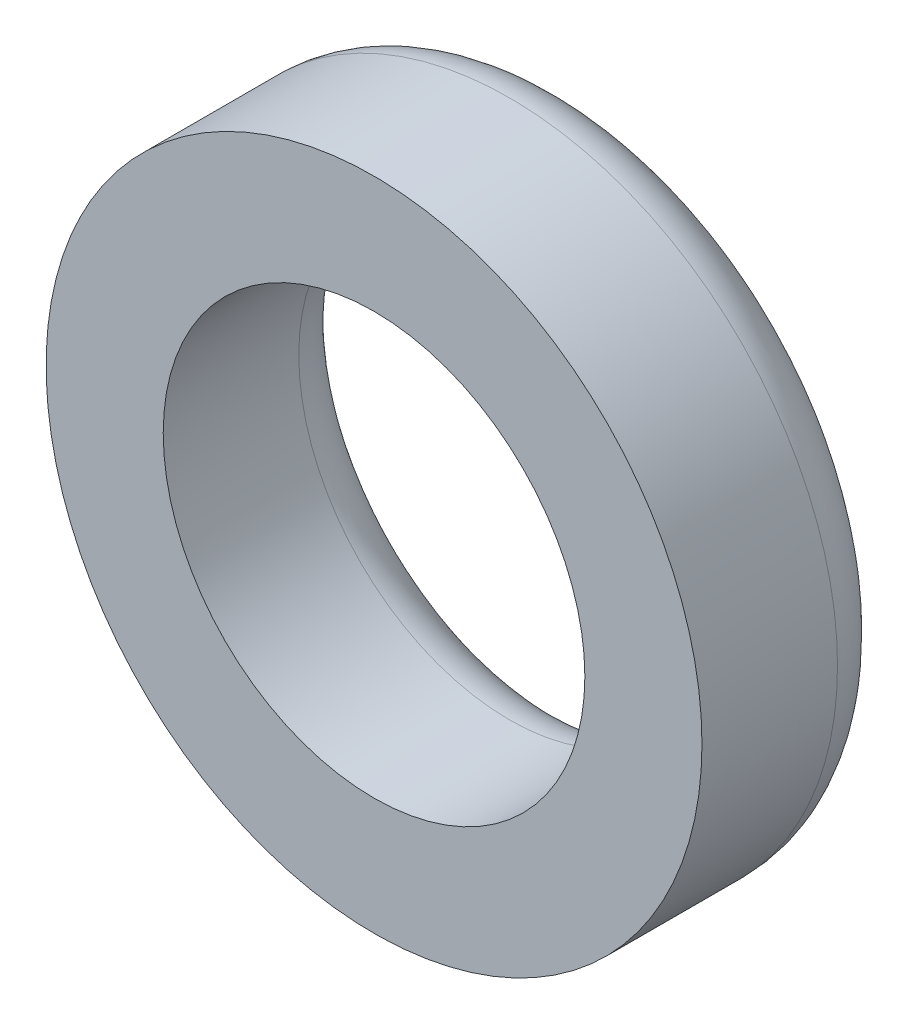
from build123d import *

# Parameters (mm, degrees)
CROQUIS1_W  = 3.5
CROQUIS1_H  = 5.8
REDONDEO1_R = 1.75


with BuildPart() as part:
    # Croquis1 → Revolución1 (revolve)
    with BuildSketch(Plane(origin=(0, 0, 0), x_dir=(1, 0, 0), z_dir=(0, 1, 0))):
        with Locations((8.05, 2.9)):
            Rectangle(CROQUIS1_W, CROQUIS1_H)
    revolve(axis=Axis((0, 0, 0), (0, 0, -1)))

    # Redondeo1
    redondeo1_edges = [part.edges().sort_by_distance(p)[0] for p in [
        (-9.8, 0, -5.8),
        (-6.3, 0, -5.8),
    ]]
    fillet(redondeo1_edges, radius=REDONDEO1_R - 0.0001)  # a hair under: the kernel refuses the full size


solid = part.part
